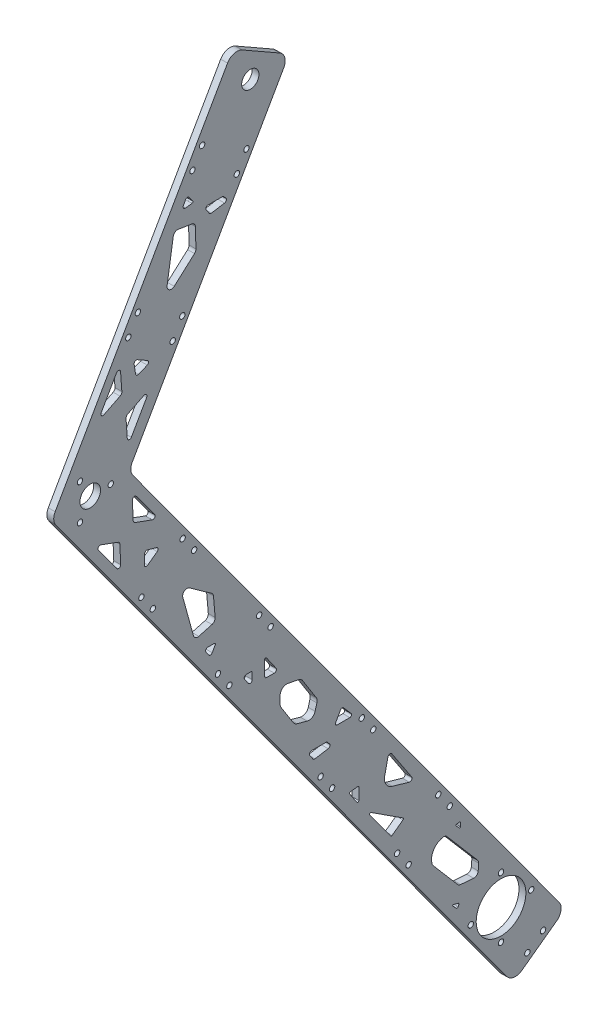
from build123d import *

# Parameters (mm, degrees)
SKETCH3_R                           = 4
SKETCH3_R_2                         = 4.765
SKETCH3_R_3                         = 11.5
BOSS_ROCKER_BASE_DEPTH              = 3.18
SKETCH4_R                           = 1.25
CUT_MOTOR_HOLES_SHAFT_SUPPORT_DEPTH = 3.18
SKETCH5_R                           = 1.25
CUT_SUPPORT_HOLES_DEPTH             = 3.18
CUT_LIGHTENING_HOLES_DEPTH          = 3.18


with BuildPart() as part:
    # Sketch3 → Boss-rocker base (new body)
    with BuildSketch(Plane.YZ):
        with BuildLine():
            Line((-3.626649793, 206.112706863), (-289.03382674, -2.652716496))
            ThreePointArc((-289.03382674, -2.652716496), (-291.022843538, -5.922039532), (-290.117530314, -9.640247287))
            Line((-290.117530314, -9.640247287), (-278.309875879, -25.782716018))
            ThreePointArc((-278.309875879, -25.782716018), (-275.040552842, -27.771732816), (-271.322345088, -26.866419592))
            Line((-271.322345088, -26.866419592), (-1.602441241, 170.424309102))
            ThreePointArc((-1.602441241, 170.424309102), (1.066332673, 171.380668673), (3.826130086, 170.732211983))
            Line((3.826130086, 170.732211983), (126.91354691, 100.548260636))
            ThreePointArc((126.91354691, 100.548260636), (130.710275653, 100.069186741), (133.733724692, 102.415122982))
            Line((133.733724692, 102.415122982), (143.640355564, 119.789203239))
            ThreePointArc((143.640355564, 119.789203239), (144.119429459, 123.585931982), (141.773493218, 126.609381021))
            Line((141.773493218, 126.609381021), (1.801921534, 206.420609744))
            ThreePointArc((1.801921534, 206.420609744), (-0.957875878, 207.069066434), (-3.626649793, 206.112706863))
        make_face()
        with Locations((130, 116.055478547)):
            Circle(SKETCH3_R, mode=Mode.SUBTRACT)
        with Locations((0, 190.180957093)):
            Circle(SKETCH3_R_2, mode=Mode.SUBTRACT)
        with Locations((-260, 0)):
            Circle(SKETCH3_R_3, mode=Mode.SUBTRACT)
    extrude(amount=BOSS_ROCKER_BASE_DEPTH)

    # Sketch4 → Cut-motor holes + shaft support (cut)
    with BuildSketch(Plane.YZ):
        with Locations((-260, -14)):
            Circle(SKETCH4_R)
        with Locations((-260, 14)):
            Circle(SKETCH4_R)
        with Locations((-274, 0)):
            Circle(SKETCH4_R)
        with Locations((-246, 0)):
            Circle(SKETCH4_R)
        with Locations((0, 180.656752709)):
            Circle(SKETCH4_R)
        with Locations((-8.24, 194.928851363)):
            Circle(SKETCH4_R)
        with Locations((8.24, 194.928851363)):
            Circle(SKETCH4_R)
    extrude(amount=CUT_MOTOR_HOLES_SHAFT_SUPPORT_DEPTH, mode=Mode.SUBTRACT)

    # Sketch5 → Cut-support holes (cut)
    with BuildSketch(Plane.YZ):
        with Locations((-173.097097557, 78.211050768)):
            Circle(SKETCH5_R)
        with Locations((-165.832986628, 83.524495264)):
            Circle(SKETCH5_R)
        with Locations((-159.140450015, 59.130652728)):
            Circle(SKETCH5_R)
        with Locations((-151.876339086, 64.444097223)):
            Circle(SKETCH5_R)
        with Locations((-86.902902443, 111.969906325)):
            Circle(SKETCH5_R)
        with Locations((-94.167013372, 106.656461829)):
            Circle(SKETCH5_R)
        with Locations((-100.859549985, 131.050304365)):
            Circle(SKETCH5_R)
        with Locations((-108.123660914, 125.73685987)):
            Circle(SKETCH5_R)
        with Locations((-221.524503751, 42.788087462)):
            Circle(SKETCH5_R)
        with Locations((-214.260392822, 48.101531958)):
            Circle(SKETCH5_R)
        with Locations((-200.30374528, 29.021133918)):
            Circle(SKETCH5_R)
        with Locations((-207.567856209, 23.707689422)):
            Circle(SKETCH5_R)
        with Locations((-38.475496249, 147.392869631)):
            Circle(SKETCH5_R)
        with Locations((-45.739607178, 142.079425135)):
            Circle(SKETCH5_R)
        with Locations((-59.69625472, 161.159823175)):
            Circle(SKETCH5_R)
        with Locations((-52.432143791, 166.473267671)):
            Circle(SKETCH5_R)
        with Locations((95.189202735, 122.297979862)):
            Circle(SKETCH5_R)
        with Locations((103.007538851, 117.839995969)):
            Circle(SKETCH5_R)
        with Locations((114.717176541, 138.376158833)):
            Circle(SKETCH5_R)
        with Locations((106.898840426, 142.834142725)):
            Circle(SKETCH5_R)
        with Locations((62.594935771, 168.096051448)):
            Circle(SKETCH5_R)
        with Locations((50.885298081, 147.559888585)):
            Circle(SKETCH5_R)
        with Locations((43.066961965, 152.017872477)):
            Circle(SKETCH5_R)
        with Locations((54.776599656, 172.554035341)):
            Circle(SKETCH5_R)
        with Locations((-284.303772817, -12.202009133)):
            Circle(SKETCH5_R)
        with Locations((-278.990328321, -19.466120062)):
            Circle(SKETCH5_R)
    extrude(amount=CUT_SUPPORT_HOLES_DEPTH, mode=Mode.SUBTRACT)

    # Sketch6 → Cut-lightening holes (cut)
    with BuildSketch(Plane.YZ):
        with BuildLine():
            Line((-10.769787121, 168.850828722), (-22.35849324, 160.358178067))
            ThreePointArc((-22.35849324, 160.358178067), (-23.549370942, 160.364603578), (-23.889631154, 161.505854634))
            Line((-23.889631154, 161.505854634), (-21.056425779, 169.314282813))
            ThreePointArc((-21.056425779, 169.314282813), (-20.533401198, 170.012282567), (-19.71045993, 170.301291285))
            Line((-19.71045993, 170.301291285), (-11.403614469, 170.656510937))
            ThreePointArc((-11.403614469, 170.656510937), (-10.417332829, 169.988630178), (-10.769787121, 168.850828722))
        make_face()
        with BuildLine():
            Line((-79.983471427, 142.368791683), (-61.979782767, 147.316428458))
            ThreePointArc((-61.979782767, 147.316428458), (-59.811067724, 146.534457497), (-59.819745898, 144.229088067))
            Line((-59.819745898, 144.229088067), (-67.122963599, 133.95613022))
            ThreePointArc((-67.122963599, 133.95613022), (-67.760393878, 133.378682327), (-68.581402, 133.122344477))
            Line((-68.581402, 133.122344477), (-77.604831251, 132.34516891))
            ThreePointArc((-77.604831251, 132.34516891), (-78.919471752, 132.69660063), (-79.704956379, 133.807815192))
            Line((-79.704956379, 133.807815192), (-81.381998087, 139.910311831))
            ThreePointArc((-81.381998087, 139.910311831), (-81.191902606, 141.429196112), (-79.983471427, 142.368791683))
        make_face()
        with BuildLine():
            Line((-23.590243446, 186.37791816), (-35.194117114, 177.906003349))
            ThreePointArc((-35.194117114, 177.906003349), (-35.548706119, 176.769122694), (-34.564130708, 176.099165796))
            Line((-34.564130708, 176.099165796), (-26.264347501, 176.434131554))
            ThreePointArc((-26.264347501, 176.434131554), (-25.440715053, 176.72116458), (-24.916016948, 177.417907193))
            Line((-24.916016948, 177.417907193), (-22.061370004, 185.226931033))
            ThreePointArc((-22.061370004, 185.226931033), (-22.399134797, 186.36917931), (-23.590243446, 186.37791816))
        make_face()
        with BuildLine():
            Line((-41.006254979, 163.554066473), (-37.796701938, 159.166225528))
            ThreePointArc((-37.796701938, 159.166225528), (-36.810829246, 158.772713589), (-36.026370609, 159.48785082))
            Line((-36.026370609, 159.48785082), (-34.845722085, 163.719212835))
            ThreePointArc((-34.845722085, 163.719212835), (-35.001806541, 164.578352986), (-35.773309829, 164.987335665))
            Line((-35.773309829, 164.987335665), (-40.163511394, 165.143814596))
            ThreePointArc((-40.163511394, 165.143814596), (-41.082663718, 164.612819663), (-41.006254979, 163.554066473))
        make_face()
        with BuildLine():
            Line((-89.370674465, 136.583707549), (-91.116796619, 135.414780442))
            ThreePointArc((-91.116796619, 135.414780442), (-91.559865615, 134.548155622), (-91.056187767, 133.715294686))
            Line((-91.056187767, 133.715294686), (-88.562222197, 132.291893426))
            ThreePointArc((-88.562222197, 132.291893426), (-88.063302805, 132.293754391), (-87.814378781, 132.726144093))
            Line((-87.814378781, 132.726144093), (-87.814378781, 135.752723126))
            ThreePointArc((-87.814378781, 135.752723126), (-88.343366936, 136.634850012), (-89.370674465, 136.583707549))
        make_face()
        with BuildLine():
            Line((-123.842513182, 102.258163939), (-127.383477271, 102.258163939))
            ThreePointArc((-127.383477271, 102.258163939), (-128.217930269, 102.139776022), (-128.986523832, 101.793956069))
            Line((-128.986523832, 101.793956069), (-137.87452461, 96.175246667))
            ThreePointArc((-137.87452461, 96.175246667), (-138.681600876, 95.425877769), (-139.163866001, 94.435753436))
            Line((-139.163866001, 94.435753436), (-140.452603638, 89.754685534))
            ThreePointArc((-140.452603638, 89.754685534), (-140.168511172, 87.476227852), (-138.356514585, 86.065998684))
            Line((-138.356514585, 86.065998684), (-135.427175254, 85.259526758))
            ThreePointArc((-135.427175254, 85.259526758), (-134.189854142, 85.184508534), (-133.027829794, 85.61612258))
            Line((-133.027829794, 85.61612258), (-123.19292846, 91.833432183))
            ThreePointArc((-123.19292846, 91.833432183), (-122.319685125, 92.675710701), (-121.851449189, 93.794970338))
            Line((-121.851449189, 93.794970338), (-120.89798735, 98.683909964))
            ThreePointArc((-120.89798735, 98.683909964), (-121.527047578, 101.165680397), (-123.842513182, 102.258163939))
        make_face()
        with BuildLine():
            Line((-109.235164963, 118.721689223), (-111.687084535, 117.014102379))
            ThreePointArc((-111.687084535, 117.014102379), (-112.069688894, 115.894001736), (-111.115590781, 115.193495963))
            Line((-111.115590781, 115.193495963), (-108.16367121, 115.193495963))
            ThreePointArc((-108.16367121, 115.193495963), (-107.810117819, 115.339942572), (-107.66367121, 115.693495963))
            Line((-107.66367121, 115.693495963), (-107.66367121, 117.901082808))
            ThreePointArc((-107.66367121, 117.901082808), (-108.200796364, 118.787506452), (-109.235164963, 118.721689223))
        make_face()
        with BuildLine():
            Line((-105.726824548, 108.545774567), (-112.034458816, 104.152957845))
            ThreePointArc((-112.034458816, 104.152957845), (-113.068827416, 104.087140616), (-113.60595257, 104.973564261))
            Line((-113.60595257, 104.973564261), (-113.60595257, 108.456077775))
            ThreePointArc((-113.60595257, 108.456077775), (-113.313059351, 109.163184556), (-112.60595257, 109.456077775))
            Line((-112.60595257, 109.456077775), (-106.012571425, 109.456077775))
            ThreePointArc((-106.012571425, 109.456077775), (-105.535522369, 109.105824889), (-105.726824548, 108.545774567))
        make_face()
        with BuildLine():
            Line((-179.558789689, 70.020131058), (-184.523139675, 66.737254454))
            ThreePointArc((-184.523139675, 66.737254454), (-184.72615933, 66.176198305), (-184.24734383, 65.820197322))
            Line((-184.24734383, 65.820197322), (-178.884020859, 65.820197322))
            ThreePointArc((-178.884020859, 65.820197322), (-178.50974759, 65.988656192), (-178.38767293, 66.38051924))
            Line((-178.38767293, 66.38051924), (-178.786645915, 69.663395844))
            ThreePointArc((-178.786645915, 69.663395844), (-179.073289746, 70.056972804), (-179.558789689, 70.020131058))
        make_face()
        with BuildLine():
            Line((-173.179518759, 50.529751316), (-187.062617136, 41.348992712))
            ThreePointArc((-187.062617136, 41.348992712), (-188.206182034, 41.377149334), (-188.575130176, 42.459928509))
            Line((-188.575130176, 42.459928509), (-186.300929891, 50.354284082))
            ThreePointArc((-186.300929891, 50.354284082), (-184.055505641, 53.265590831), (-180.426317386, 53.854343461))
            Line((-180.426317386, 53.854343461), (-173.517109299, 52.340698989))
            ThreePointArc((-173.517109299, 52.340698989), (-172.74804587, 51.547125046), (-173.179518759, 50.529751316))
        make_face()
        with BuildLine():
            Line((-192.631698425, 60.807138256), (-205.83829677, 51.146970897))
            ThreePointArc((-205.83829677, 51.146970897), (-206.03719845, 50.820038593), (-205.946667128, 50.448217818))
            Line((-205.946667128, 50.448217818), (-202.259856899, 45.407909503))
            ThreePointArc((-202.259856899, 45.407909503), (-201.842082536, 45.203302904), (-201.436610598, 45.431319977))
            Line((-201.436610598, 45.431319977), (-191.91682248, 60.131795651))
            ThreePointArc((-191.91682248, 60.131795651), (-191.993146395, 60.767036922), (-192.631698425, 60.807138256))
        make_face()
        with BuildLine():
            Line((-154.874496589, 88.49279264), (-156.945885214, 87.11186689))
            ThreePointArc((-156.945885214, 87.11186689), (-157.308056371, 86.678999413), (-157.378165311, 86.118975363))
            Line((-157.378165311, 86.118975363), (-156.383483264, 80.015244624))
            ThreePointArc((-156.383483264, 80.015244624), (-155.736790272, 79.235764341), (-154.741030112, 79.420867127))
            Line((-154.741030112, 79.420867127), (-153.664323533, 80.355367177))
            ThreePointArc((-153.664323533, 80.355367177), (-153.409996179, 80.695539439), (-153.319796393, 81.110585906))
            Line((-153.319796393, 81.110585906), (-153.319796393, 87.660742346))
            ThreePointArc((-153.319796393, 87.660742346), (-153.847938467, 88.542416945), (-154.874496589, 88.49279264))
        make_face()
        with BuildLine():
            Line((-143.504495682, 72.946475235), (-147.601862544, 69.390270035))
            ThreePointArc((-147.601862544, 69.390270035), (-148.458278006, 69.266604847), (-148.926240832, 69.994445019))
            Line((-148.926240832, 69.994445019), (-148.926240832, 75.884018058))
            ThreePointArc((-148.926240832, 75.884018058), (-148.52829084, 76.575650758), (-147.730351354, 76.579195389))
            Line((-147.730351354, 76.579195389), (-143.632984493, 74.24582755))
            ThreePointArc((-143.632984493, 74.24582755), (-143.232756956, 73.629375694), (-143.504495682, 72.946475235))
        make_face()
        with BuildLine():
            Line((-227.536912906, 31.443521835), (-240.812092581, 20.074883922))
            ThreePointArc((-240.812092581, 20.074883922), (-241.294394217, 19.461411125), (-241.505216951, 18.71006732))
            Line((-241.505216951, 18.71006732), (-241.969357294, 12.71062362))
            ThreePointArc((-241.969357294, 12.71062362), (-241.494399162, 11.255439603), (-240.129582559, 10.562315233))
            Line((-240.129582559, 10.562315233), (-237.156438151, 10.332301196))
            ThreePointArc((-237.156438151, 10.332301196), (-236.381608619, 10.425053213), (-235.701254134, 10.807259329))
            Line((-235.701254134, 10.807259329), (-219.133655325, 24.995468947))
            ThreePointArc((-219.133655325, 24.995468947), (-218.552793599, 25.837124808), (-218.463915883, 26.855891554))
            ThreePointArc((-218.463915883, 26.855891554), (-221.531743706, 31.287956059), (-226.896432107, 31.812247659))
            ThreePointArc((-226.896432107, 31.812247659), (-227.233851743, 31.657725269), (-227.536912906, 31.443521835))
        make_face()
        with BuildLine():
            Line((-248.393612971, 22.29474187), (-250.022544898, 20.665809944))
            ThreePointArc((-250.022544898, 20.665809944), (-250.160762634, 20.22191742), (-249.873805448, 19.856130201))
            Line((-249.873805448, 19.856130201), (-249.111541751, 19.513851727))
            ThreePointArc((-249.111541751, 19.513851727), (-248.687507787, 19.52059786), (-248.421180982, 19.850628686))
            Line((-248.421180982, 19.850628686), (-247.89015284, 22.0110002))
            ThreePointArc((-247.89015284, 22.0110002), (-248.034187563, 22.343961442), (-248.393612971, 22.29474187))
        make_face()
        with BuildLine():
            Line((-216.935181556, 20.829053028), (-218.506768223, 19.257466361))
            ThreePointArc((-218.506768223, 19.257466361), (-218.571800048, 18.930529297), (-218.294636189, 18.745334327))
            Line((-218.294636189, 18.745334327), (-216.651140925, 18.745334327))
            ThreePointArc((-216.651140925, 18.745334327), (-216.264292411, 18.928556444), (-216.160960712, 19.343941418))
            Line((-216.160960712, 19.343941418), (-216.428941394, 20.676085248))
            ThreePointArc((-216.428941394, 20.676085248), (-216.63627507, 20.904097237), (-216.935181556, 20.829053028))
        make_face()
        with BuildLine():
            Line((93.747839596, 143.024163005), (93.405611769, 146.031331234))
            ThreePointArc((93.405611769, 146.031331234), (93.831461547, 146.967615527), (94.857963383, 147.032962982))
            Line((94.857963383, 147.032962982), (96.725062305, 146.068973991))
            ThreePointArc((96.725062305, 146.068973991), (97.263282559, 145.258006869), (96.857010058, 144.373534502))
            Line((96.857010058, 144.373534502), (94.539989279, 142.677259135))
            ThreePointArc((94.539989279, 142.677259135), (94.044059253, 142.622693282), (93.747839596, 143.024163005))
        make_face()
        with BuildLine():
            Line((85.568117513, 143.181930885), (86.544369033, 149.434919538))
            ThreePointArc((86.544369033, 149.434919538), (86.183746182, 150.922567652), (84.87682125, 151.719494858))
            Line((84.87682125, 151.719494858), (66.429148509, 154.599648582))
            ThreePointArc((66.429148509, 154.599648582), (64.362763101, 153.577467158), (64.632063287, 151.28786437))
            Line((64.632063287, 151.28786437), (73.050048081, 141.906596667))
            ThreePointArc((73.050048081, 141.906596667), (73.74868466, 141.404929088), (74.593412473, 141.243070035))
            Line((74.593412473, 141.243070035), (83.646848899, 141.491195361))
            ThreePointArc((83.646848899, 141.491195361), (84.913320183, 141.989025039), (85.568117513, 143.181930885))
        make_face()
        with BuildLine():
            Line((14.02466099, 171.152994101), (26.499342742, 164.025193609))
            ThreePointArc((26.499342742, 164.025193609), (27.681856253, 164.166235385), (27.890888241, 165.33864172))
            Line((27.890888241, 165.33864172), (24.192922162, 172.776628693))
            ThreePointArc((24.192922162, 172.776628693), (23.594326249, 173.411011307), (22.743983458, 173.605113104))
            Line((22.743983458, 173.605113104), (14.450247353, 173.018765153))
            ThreePointArc((14.450247353, 173.018765153), (13.545811221, 172.243644861), (14.02466099, 171.152994101))
        make_face()
        with BuildLine():
            Line((43.754076345, 168.361583713), (41.061258952, 163.638966497))
            ThreePointArc((41.061258952, 163.638966497), (40.126205126, 163.136501617), (39.265914045, 163.758350367))
            Line((39.265914045, 163.758350367), (37.614379918, 167.829073947))
            ThreePointArc((37.614379918, 167.829073947), (37.6723168, 168.700353164), (38.392626727, 169.193949927))
            Line((38.392626727, 169.193949927), (42.736978247, 169.845843563))
            ThreePointArc((42.736978247, 169.845843563), (43.710277432, 169.422186498), (43.754076345, 168.361583713))
        make_face()
        with BuildLine():
            Line((33.137619272, 176.360969246), (29.418281786, 183.797123573))
            ThreePointArc((29.418281786, 183.797123573), (29.624721599, 184.970238565), (30.807202998, 185.113604958))
            Line((30.807202998, 185.113604958), (43.294610334, 178.008122379))
            ThreePointArc((43.294610334, 178.008122379), (43.775477006, 176.918627895), (42.872970918, 176.14163771))
            Line((42.872970918, 176.14163771), (34.588541965, 175.53596432))
            ThreePointArc((34.588541965, 175.53596432), (33.737735826, 175.728024943), (33.137619272, 176.360969246))
        make_face()
        with BuildLine():
            Line((89.425255436, 129.07009069), (89.425255436, 135.620247129))
            ThreePointArc((89.425255436, 135.620247129), (88.897113362, 136.501921728), (87.87055524, 136.452297424))
            Line((87.87055524, 136.452297424), (85.799166615, 135.071371674))
            ThreePointArc((85.799166615, 135.071371674), (85.436995458, 134.638504196), (85.366886519, 134.078480146))
            Line((85.366886519, 134.078480146), (86.361568565, 127.974749407))
            ThreePointArc((86.361568565, 127.974749407), (87.008261557, 127.195269124), (88.004021717, 127.38037191))
            Line((88.004021717, 127.38037191), (89.080728296, 128.31487196))
            ThreePointArc((89.080728296, 128.31487196), (89.335055651, 128.655044222), (89.425255436, 129.07009069))
        make_face()
    extrude(amount=CUT_LIGHTENING_HOLES_DEPTH, mode=Mode.SUBTRACT)


solid = part.part
